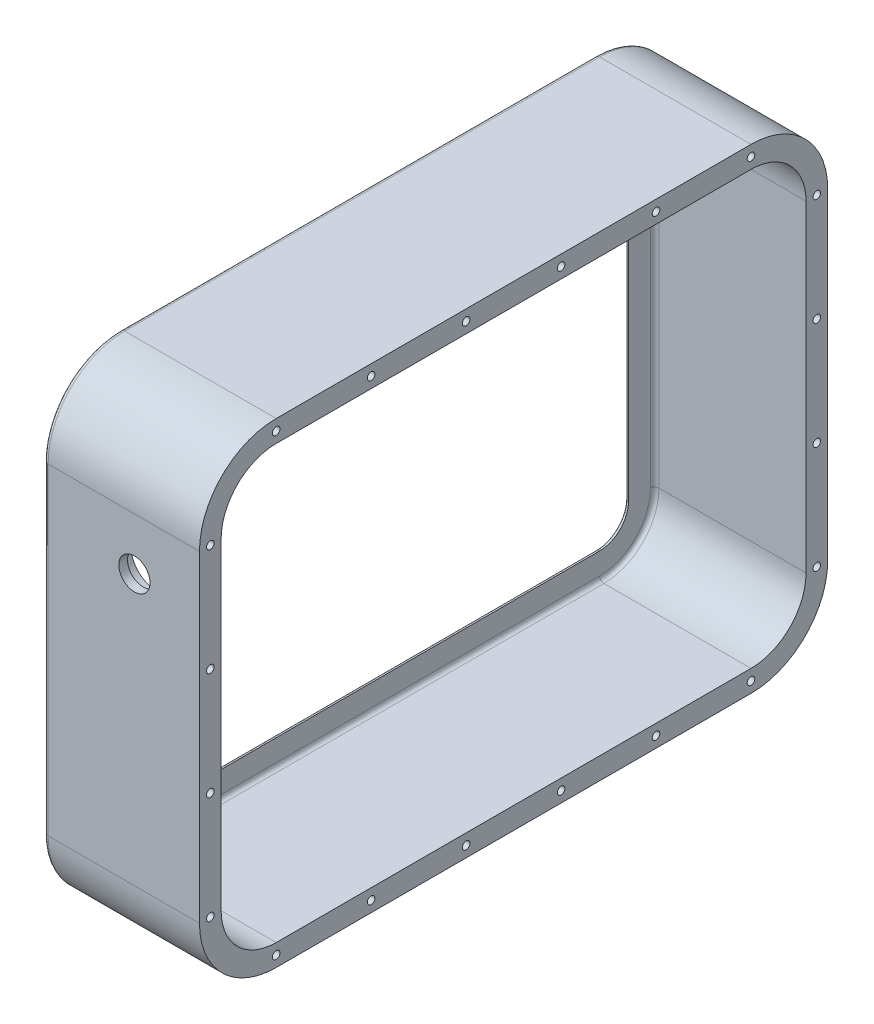
from build123d import *

# Parameters (mm, degrees)
EXTRUDE_THIN1_DEPTH      = 34.925
EXTRUDE_THIN1_DEPTH_BACK = 1
EXTRUDE_THIN2_START      = -1
EXTRUDE_THIN2_DEPTH      = 1
FILLET1_R                = 1
SKETCH2_R                = 0.875
CUT_EXTRUDE1_DEPTH       = 6
MIRROR2_COPY_1_SKETCH_R  = 0.875
MIRROR2_COPY_1_DEPTH     = 6
CUT_EXTRUDE2_REACH       = 160.855
SKETCH3_R                = 3.6
CUT_EXTRUDE3_REACH       = 162.855
CUT_EXTRUDE3_START       = -2
SKETCH4_R                = 5.8
SKETCH5_R                = 0.9
CUT_EXTRUDE4_DEPTH       = 4


with BuildPart() as part:
    # Sketch1 → Extrude-Thin1 (new, two sides: drawn at the far end of the back side and taken through both)
    with BuildSketch(Plane(origin=(0, 0, 0), x_dir=(0, 0, -1), z_dir=(1, 0, 0)).offset(-EXTRUDE_THIN1_DEPTH_BACK)):
        with BuildLine():
            Line((72.46875, -37.1475), (72.46875, 37.1475))
            ThreePointArc((72.46875, 37.1475), (67.284540027, 49.663290027), (54.76875, 54.8475))
            Line((54.76875, 54.8475), (-54.76875, 54.8475))
            ThreePointArc((-54.76875, 54.8475), (-67.284540027, 49.663290027), (-72.46875, 37.1475))
            Line((-72.46875, 37.1475), (-72.46875, -37.1475))
            ThreePointArc((-72.46875, -37.1475), (-67.284540027, -49.663290027), (-54.76875, -54.8475))
            Line((-54.76875, -54.8475), (54.76875, -54.8475))
            ThreePointArc((54.76875, -54.8475), (67.284540027, -49.663290027), (72.46875, -37.1475))
        make_face()
        with BuildLine():
            Line((67.46875, -37.1475), (67.46875, 37.1475))
            ThreePointArc((67.46875, 37.1475), (63.749006121, 46.127756121), (54.76875, 49.8475))
            Line((54.76875, 49.8475), (-54.76875, 49.8475))
            ThreePointArc((-54.76875, 49.8475), (-63.749006121, 46.127756121), (-67.46875, 37.1475))
            Line((-67.46875, 37.1475), (-67.46875, -37.1475))
            ThreePointArc((-67.46875, -37.1475), (-63.749006121, -46.127756121), (-54.76875, -49.8475))
            Line((-54.76875, -49.8475), (54.76875, -49.8475))
            ThreePointArc((54.76875, -49.8475), (63.749006121, -46.127756121), (67.46875, -37.1475))
        make_face(mode=Mode.SUBTRACT)
    extrude(amount=EXTRUDE_THIN1_DEPTH + EXTRUDE_THIN1_DEPTH_BACK)

    # Sketch1<2> → Extrude-Thin2 (add)
    with BuildSketch(Plane(origin=(0, 0, 0), x_dir=(0, 0, -1), z_dir=(1, 0, 0)).offset(EXTRUDE_THIN2_START)):
        with BuildLine():
            Line((67.46875, -37.1475), (67.46875, 37.1475))
            ThreePointArc((67.46875, 37.1475), (63.749006121, 46.127756121), (54.76875, 49.8475))
            Line((54.76875, 49.8475), (-54.76875, 49.8475))
            ThreePointArc((-54.76875, 49.8475), (-63.749006121, 46.127756121), (-67.46875, 37.1475))
            Line((-67.46875, 37.1475), (-67.46875, -37.1475))
            ThreePointArc((-67.46875, -37.1475), (-63.749006121, -46.127756121), (-54.76875, -49.8475))
            Line((-54.76875, -49.8475), (54.76875, -49.8475))
            ThreePointArc((54.76875, -49.8475), (63.749006121, -46.127756121), (67.46875, -37.1475))
        make_face()
        with BuildLine():
            Line((61.46875, -37.1475), (61.46875, 37.1475))
            ThreePointArc((61.46875, 37.1475), (59.506365434, 41.885115434), (54.76875, 43.8475))
            Line((54.76875, 43.8475), (-54.76875, 43.8475))
            ThreePointArc((-54.76875, 43.8475), (-59.506365434, 41.885115434), (-61.46875, 37.1475))
            Line((-61.46875, 37.1475), (-61.46875, -37.1475))
            ThreePointArc((-61.46875, -37.1475), (-59.506365434, -41.885115434), (-54.76875, -43.8475))
            Line((-54.76875, -43.8475), (54.76875, -43.8475))
            ThreePointArc((54.76875, -43.8475), (59.506365434, -41.885115434), (61.46875, -37.1475))
        make_face(mode=Mode.SUBTRACT)
    extrude(amount=EXTRUDE_THIN2_DEPTH)

    # Fillet1
    fillet1_edges = [part.edges().sort_by_distance(p)[0] for p in [
        (-1, -49.663290027, -67.284540027),
        (-1, -54.8475, 0),
        (-1, -49.663290027, 67.284540027),
        (-1, 0, 72.46875),
        (-1, 49.663290027, 67.284540027),
        (-1, 54.8475, 0),
        (-1, 49.663290027, -67.284540027),
        (-1, 0, -72.46875),
        (-1, -41.885115434, -59.506365434),
        (-1, -43.8475, 0),
        (-1, -41.885115434, 59.506365434),
        (-1, 0, 61.46875),
        (-1, 41.885115434, 59.506365434),
        (-1, 43.8475, 0),
        (-1, 41.885115434, -59.506365434),
        (-1, 0, -61.46875),
        (0, 49.8475, 0),
        (0, 46.127756121, -63.749006121),
        (0, 0, -67.46875),
        (0, -46.127756121, -63.749006121),
        (0, -49.8475, 0),
        (0, -46.127756121, 63.749006121),
        (0, 0, 67.46875),
        (0, 46.127756121, 63.749006121),
    ]]
    fillet(fillet1_edges, radius=FILLET1_R - 0.0001)  # a hair under: the kernel refuses the full size

    # Sketch2 → Cut-Extrude1 (cut)
    with BuildSketch(Plane(origin=(34.925, 0, 0), x_dir=(0, 0, -1), z_dir=(1, 0, 0))):
        with Locations((69.96875, -37.1475)):
            Circle(SKETCH2_R)
        with Locations((69.96875, -12.3825)):
            Circle(SKETCH2_R)
        with Locations((54.76875, -52.3475)):
            Circle(SKETCH2_R)
        with Locations((10.95375, -52.3475)):
            Circle(SKETCH2_R)
        with Locations((32.86125, -52.3475)):
            Circle(SKETCH2_R)
    cut_extrude1 = extrude(amount=-CUT_EXTRUDE1_DEPTH, mode=Mode.SUBTRACT)

    # Mirror1: Cut-Extrude1 across plane
    add(cut_extrude1.mirror(Plane.XY), mode=Mode.SUBTRACT)

    # Mirror2: Cut-Extrude1 across plane
    add(cut_extrude1.mirror(Plane.ZX), mode=Mode.SUBTRACT)

    # Mirror2 copy 1 sketch → Mirror2 copy 1 (cut)
    with BuildSketch(Plane(origin=(34.925, 0, 0), x_dir=(0, 0, 1), z_dir=(1, 0, 0))):
        with Locations((69.96875, -37.1475)):
            Circle(MIRROR2_COPY_1_SKETCH_R)
        with Locations((69.96875, -12.3825)):
            Circle(MIRROR2_COPY_1_SKETCH_R)
        with Locations((54.76875, -52.3475)):
            Circle(MIRROR2_COPY_1_SKETCH_R)
        with Locations((10.95375, -52.3475)):
            Circle(MIRROR2_COPY_1_SKETCH_R)
        with Locations((32.86125, -52.3475)):
            Circle(MIRROR2_COPY_1_SKETCH_R)
    extrude(amount=-MIRROR2_COPY_1_DEPTH, mode=Mode.SUBTRACT)

    # Sketch3 → Cut-Extrude2 (cut, up to next)
    with BuildSketch(Plane.XY.offset(72.46875), mode=Mode.PRIVATE) as cut_extrude2_sk1:
        with Locations((19.925, 25.1475)):
            Circle(SKETCH3_R)
    cut_extrude2_tool1 = extrude(cut_extrude2_sk1.sketch, amount=-CUT_EXTRUDE2_REACH, mode=Mode.PRIVATE) & part.part
    add(cut_extrude2_tool1.solids().sort_by_distance((19.925, 25.1475, 72.46875))[0], mode=Mode.SUBTRACT)

    # Sketch4 → Cut-Extrude3 (cut, up to next)
    with BuildSketch(Plane.XY.offset(72.46875).offset(CUT_EXTRUDE3_START), mode=Mode.PRIVATE) as cut_extrude3_sk1:
        with Locations((19.925, 25.1475)):
            Circle(SKETCH4_R)
    cut_extrude3_tool1 = extrude(cut_extrude3_sk1.sketch, amount=-CUT_EXTRUDE3_REACH, mode=Mode.PRIVATE) & part.part
    add(cut_extrude3_tool1.solids().sort_by_distance((19.925, 25.1475, 70.46875))[0], mode=Mode.SUBTRACT)

    # Sketch5 → Cut-Extrude4 (cut)
    with BuildSketch(Plane(origin=(0, 0, 67.46875), x_dir=(-1, 0, 0), z_dir=(0, 0, -1))):
        with Locations(Location((-19.925, 35.1475, 0), (0, 0, 90))):
            Circle(SKETCH5_R)
        with Locations(Location((-19.925, 15.1475, 0), (0, 0, 90))):
            Circle(SKETCH5_R)
    extrude(amount=-CUT_EXTRUDE4_DEPTH, mode=Mode.SUBTRACT)


solid = part.part
